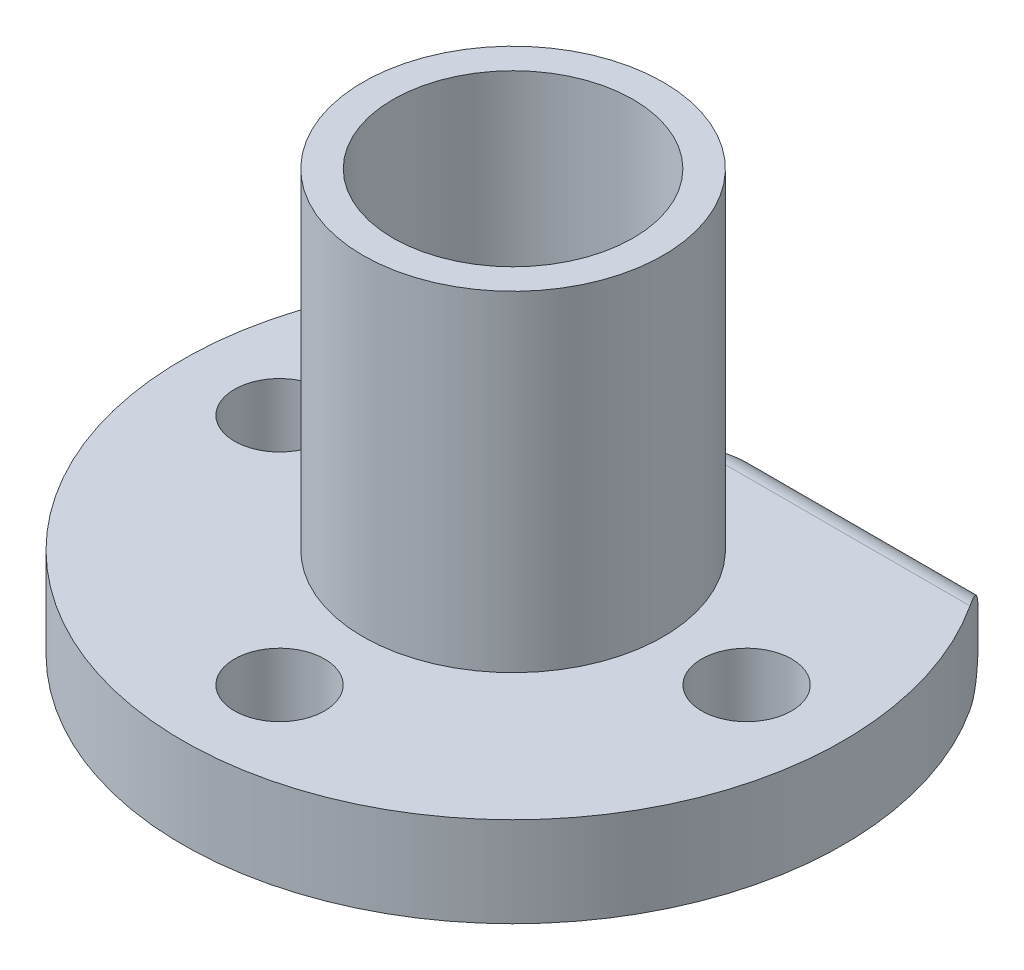
from build123d import *

# Parameters (mm, degrees)
ESQUISSE2_R             = 1.5
ENL_V_MAT_EXTRU_1_DEPTH = 21.928449536
ESQUISSE3_W             = 16.970562748
ESQUISSE3_H             = 7.774498086
ENL_V_MAT_EXTRU_2_DEPTH = 20.052558883
CONG_1_R                = 1


with BuildPart() as part:
    # Esquisse1 → Révolution1 (revolve)
    with BuildSketch(Plane.XY):
        Polygon((4, 0), (4, 15), (5, 15), (5, 4), (11, 4), (11, 1), (5, 1), (5, 0), align=None)
    revolve(axis=Axis((0, 0, 0), (0, 1, 0)))

    # Esquisse2 → Enlèv. mat.-Extru.1 (cut, through all)
    with BuildSketch(Plane.XZ.offset(-1)):
        with Locations((7.778174593, 0)):
            Circle(ESQUISSE2_R)
        with Locations((0, -7.778174593)):
            Circle(ESQUISSE2_R)
        with Locations((-7.778174593, 0)):
            Circle(ESQUISSE2_R)
        with Locations((0, 7.778174593)):
            Circle(ESQUISSE2_R)
    extrude(amount=-ENL_V_MAT_EXTRU_1_DEPTH, mode=Mode.SUBTRACT)

    # Esquisse3 → Enlèv. mat.-Extru.2 (cut, through all)
    with BuildSketch(Plane(origin=(0, 4, 0), x_dir=(1, 0, 0), z_dir=(0, 1, 0))):
        with Locations((0, 10.887249043)):
            Rectangle(ESQUISSE3_W, ESQUISSE3_H)
    extrude(amount=-ENL_V_MAT_EXTRU_2_DEPTH, mode=Mode.SUBTRACT)

    # Congé1
    cong_1_edges = [part.edges().sort_by_distance(p)[0] for p in [
        (-4.883820128, 1, -7),
        (-4.883820128, 4, -7),
    ]]
    fillet(cong_1_edges, radius=CONG_1_R)


solid = part.part
